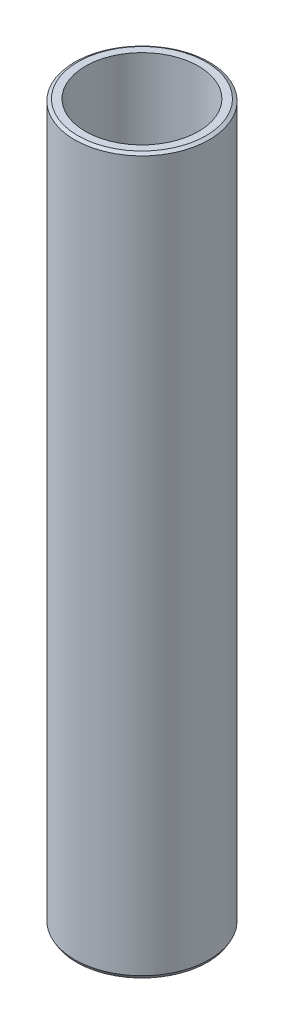
from build123d import *
from OCP.BRepFilletAPI import BRepFilletAPI_MakeChamfer

# Parameters (mm, degrees)
SKETCH1_R           = 45
BOSS_EXTRUDE1_DEPTH = 478.072123829
SKETCH2_R           = 37.810571647
CUT_EXTRUDE1_DEPTH  = 483.289286199
CHAMFER1_SIZE       = 1.266539955
CHAMFER1_SIZE2      = 2.193711552


with BuildPart() as part:
    # Sketch1 → Boss-Extrude1 (new body)
    with BuildSketch(Plane(origin=(0, 0, 0), x_dir=(1, 0, 0), z_dir=(0, 1, 0))):
        Circle(SKETCH1_R)
    extrude(amount=BOSS_EXTRUDE1_DEPTH)

    # Sketch2 → Cut-Extrude1 (cut, through all)
    with BuildSketch(Plane(origin=(0, 0, 0), x_dir=(1, 0, 0), z_dir=(0, 1, 0))):
        Circle(SKETCH2_R)
    extrude(amount=CUT_EXTRUDE1_DEPTH, mode=Mode.SUBTRACT)

    # Chamfer1: one chamfer whose edges measure the first distance from different faces: ONE call of the kernel's chamfer builder (chamfer() names one face for all edges)
    chamfer1_edges_1 = [part.edges().sort_by_distance(p)[0] for p in [
        (-45, 478.072123829, 0),
    ]]
    chamfer1_side_1 = [part.faces().sort_by_distance(p)[0] for p in [
        (-45, 239.036061915, 0),
    ]]
    chamfer1_edges_2 = [part.edges().sort_by_distance(p)[0] for p in [
        (-45, 0, 0),
    ]]
    chamfer1_side_2 = [part.faces().sort_by_distance(p)[0] for p in [
        (-43.727207794, 0, 0),
    ]]
    chamfer1 = BRepFilletAPI_MakeChamfer(part.part.solid().wrapped)
    for e in chamfer1_edges_1:
        chamfer1.Add(CHAMFER1_SIZE, CHAMFER1_SIZE2, e.wrapped, chamfer1_side_1[0].wrapped)  # the first distance lies on this face
    for e in chamfer1_edges_2:
        chamfer1.Add(CHAMFER1_SIZE, CHAMFER1_SIZE2, e.wrapped, chamfer1_side_2[0].wrapped)  # the first distance lies on this face
    add(Compound.cast(chamfer1.Shape()), mode=Mode.REPLACE)


solid = part.part
